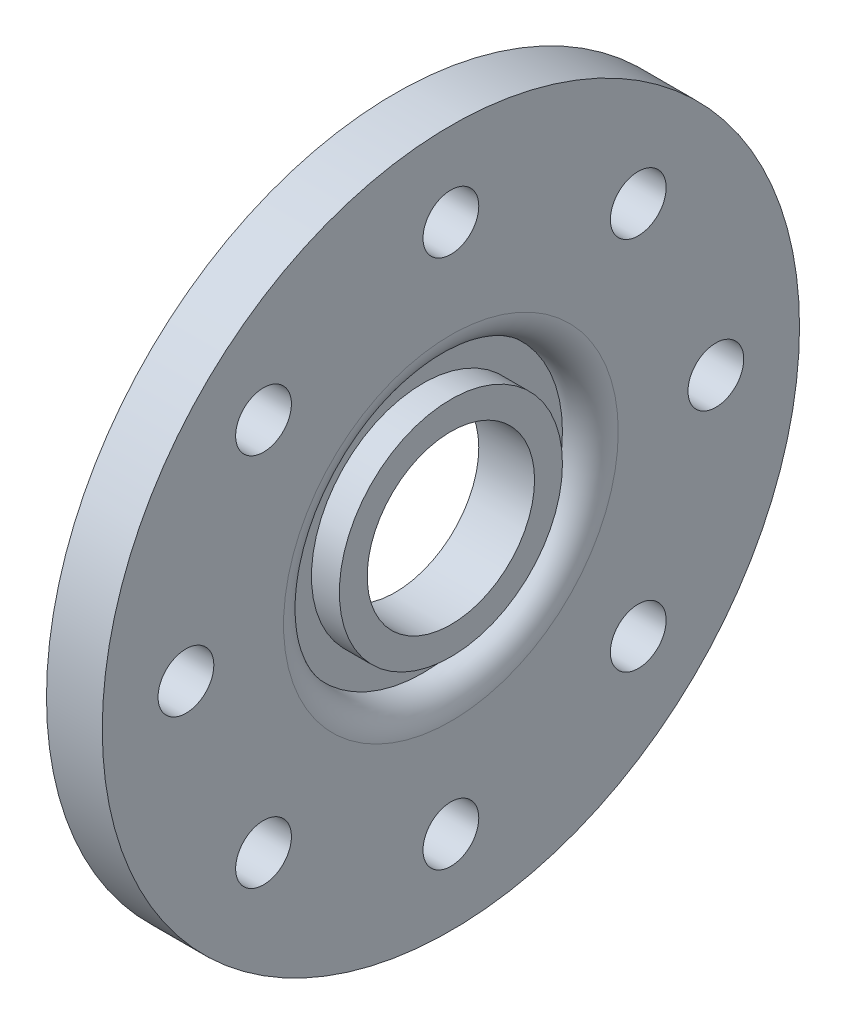
from build123d import *

# Parameters (mm, degrees)
SKETCH1_R           = 12.5
SKETCH1_R_2         = 3
SKETCH1_R_3         = 1
BOSS_EXTRUDE1_DEPTH = 2
SKETCH2_R           = 5
SKETCH2_R_2         = 4
CUT_EXTRUDE1_DEPTH  = 1
FILLET1_R           = 1


with BuildPart() as part:
    # Sketch1 → Boss-Extrude1 (new body)
    with BuildSketch(Plane(origin=(0, 0, 0), x_dir=(0, 0, -1), z_dir=(1, 0, 0))):
        Circle(SKETCH1_R)
        Circle(SKETCH1_R_2, mode=Mode.SUBTRACT)
        with Locations((9.5, 0)):
            Circle(SKETCH1_R_3, mode=Mode.SUBTRACT)
        with Locations((6.717514421, -6.717514421)):
            Circle(SKETCH1_R_3, mode=Mode.SUBTRACT)
        with Locations((0, -9.5)):
            Circle(SKETCH1_R_3, mode=Mode.SUBTRACT)
        with Locations((-6.717514421, -6.717514421)):
            Circle(SKETCH1_R_3, mode=Mode.SUBTRACT)
        with Locations((-9.5, 0)):
            Circle(SKETCH1_R_3, mode=Mode.SUBTRACT)
        with Locations((-6.717514421, 6.717514421)):
            Circle(SKETCH1_R_3, mode=Mode.SUBTRACT)
        with Locations((0, 9.5)):
            Circle(SKETCH1_R_3, mode=Mode.SUBTRACT)
        with Locations((6.717514421, 6.717514421)):
            Circle(SKETCH1_R_3, mode=Mode.SUBTRACT)
    extrude(amount=BOSS_EXTRUDE1_DEPTH)

    # Sketch2 → Cut-Extrude1 (cut)
    with BuildSketch(Plane(origin=(2, 0, 0), x_dir=(0, 0, -1), z_dir=(1, 0, 0))):
        Circle(SKETCH2_R)
        Circle(SKETCH2_R_2, mode=Mode.SUBTRACT)
    extrude(amount=-CUT_EXTRUDE1_DEPTH, mode=Mode.SUBTRACT)

    # Fillet1
    fillet1_edges = [part.edges().sort_by_distance(p)[0] for p in [
        (2, 0, 5),
    ]]
    fillet(fillet1_edges, radius=FILLET1_R - 0.0001)  # a hair under: the kernel refuses the full size


solid = part.part
